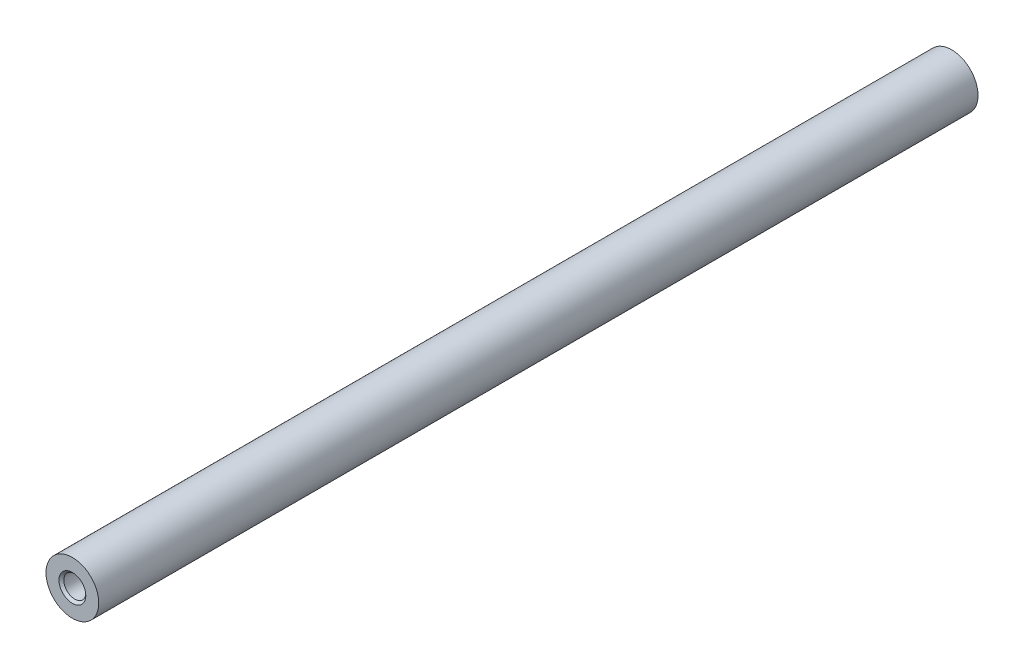
from build123d import *

# Parameters (mm, degrees)
SKETCH_1_R                   = 3
EXTRUDE_1_DEPTH              = 100
HOLE_WIZARD_M3_1_D           = 2.5
HOLE_WIZARD_M3_1_CSINK_D     = 3.05
HOLE_WIZARD_M3_1_CSINK_ANGLE = 90


with BuildPart() as part:
    # 草图1 → 凸台-拉伸1 (new body)
    with BuildSketch(Plane.XY):
        Circle(SKETCH_1_R)
    extrude(amount=EXTRUDE_1_DEPTH)

    # M3 螺纹孔1 (through all)
    with Locations(Plane.XY.offset(100)):
        with Locations((0, 0)):
            CounterSinkHole(HOLE_WIZARD_M3_1_D / 2, HOLE_WIZARD_M3_1_CSINK_D / 2, counter_sink_angle=HOLE_WIZARD_M3_1_CSINK_ANGLE)


solid = part.part
